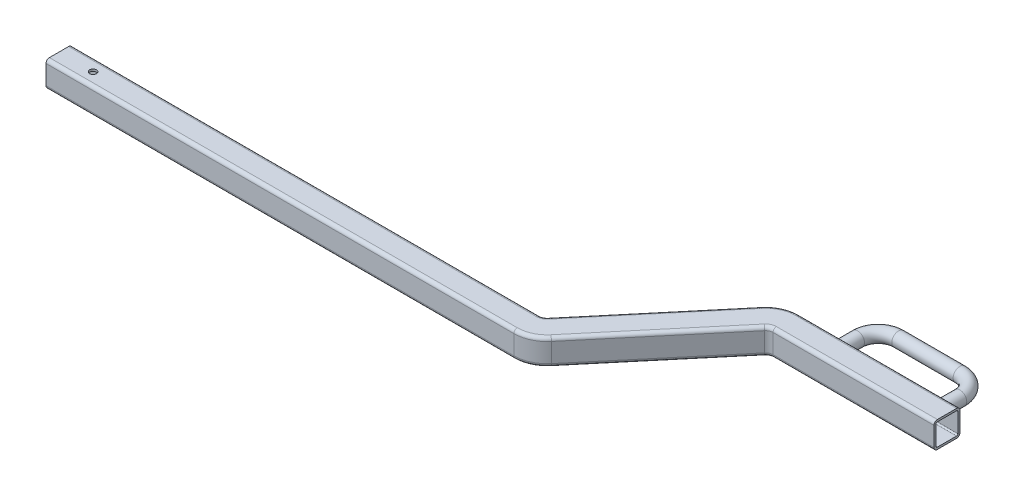
from build123d import *

# Parameters (mm, degrees)
CUT_EXTRUDE3_DEPTH      = 1131.639859977
CUT_EXTRUDE3_DEPTH_BACK = 1131.639859977
SKETCH21_R              = 5
SWEEP_THIN4_PROFILE_R   = 10
SWEEP_THIN4_PROFILE_R_2 = 7


with BuildPart() as part:
    # Sweep-Thin3: sweep along a curve in space
    with BuildLine() as sweep_thin3_path:
        Line((874.686132166, 0, -191.51111078), (1110.696902422, 0, -191.51111078))
        ThreePointArc((851.704798873, 0, -180.79473907), (862.007584314, 0, -188.700344391), (874.686132166, 0, -191.51111078))
        Line((708.992103549, 0, -10.716371709), (851.704798873, 0, -180.79473907))
        ThreePointArc((686.010770255, 0, 0), (698.689318108, 0, -2.810766389), (708.992103549, 0, -10.716371709))
        Line((0, 0, 0), (686.010770255, 0, 0))
    # Sketch2 → Sweep-Thin3 (sweep)
    with BuildSketch(Plane(origin=(0, 0, 0), x_dir=(0, 0, -1), z_dir=(1, 0, 0))):
        with BuildLine():
            Line((14.05, 19.05), (-14.05, 19.05))
            ThreePointArc((-14.05, 19.05), (-17.585533906, 17.585533906), (-19.05, 14.05))
            Line((-19.05, 14.05), (-19.05, -14.05))
            ThreePointArc((-19.05, -14.05), (-17.585533906, -17.585533906), (-14.05, -19.05))
            Line((-14.05, -19.05), (14.05, -19.05))
            ThreePointArc((14.05, -19.05), (17.585533906, -17.585533906), (19.05, -14.05))
            Line((19.05, -14.05), (19.05, 14.05))
            ThreePointArc((19.05, 14.05), (17.585533906, 17.585533906), (14.05, 19.05))
        make_face()
        with BuildLine():
            Line((14.05, 16.05), (-14.05, 16.05))
            ThreePointArc((-14.05, 16.05), (-15.464213562, 15.464213562), (-16.05, 14.05))
            Line((-16.05, 14.05), (-16.05, -14.05))
            ThreePointArc((-16.05, -14.05), (-15.464213562, -15.464213562), (-14.05, -16.05))
            Line((-14.05, -16.05), (14.05, -16.05))
            ThreePointArc((14.05, -16.05), (15.464213562, -15.464213562), (16.05, -14.05))
            Line((16.05, -14.05), (16.05, 14.05))
            ThreePointArc((16.05, 14.05), (15.464213562, 15.464213562), (14.05, 16.05))
        make_face(mode=Mode.SUBTRACT)
    sweep(path=sweep_thin3_path.line)

    # Sketch21 → Cut-Extrude3 (cut, two sides: drawn at the far end of the back side and taken through both)
    with BuildSketch(Plane(origin=(0, 0, 0), x_dir=(1, 0, 0), z_dir=(0, 1, 0)).offset(-CUT_EXTRUDE3_DEPTH_BACK)):
        with Locations((50, 0)):
            Circle(SKETCH21_R)
    extrude(amount=CUT_EXTRUDE3_DEPTH + CUT_EXTRUDE3_DEPTH_BACK, mode=Mode.SUBTRACT)

    # Sweep-Thin4: sweep along a path in Sketch25
    with BuildLine(Plane.XZ) as sweep_thin4_path:
        Line((1080.696902422, -210.56111078), (1080.696902422, -240.56111078))
        ThreePointArc((1080.696902422, -240.56111078), (1071.910105857, -261.774314215), (1050.696902422, -270.56111078))
        Line((1050.696902422, -270.56111078), (960.696902422, -270.56111078))
        ThreePointArc((960.696902422, -270.56111078), (939.483698986, -261.774314215), (930.696902422, -240.56111078))
        Line((930.696902422, -240.56111078), (930.696902422, -210.56111078))
    # Sweep-Thin4 profile (on start of the path) → Sweep-Thin4 (sweep)
    with BuildSketch(Plane(origin=(1080.696902422, 0, -210.56111078), x_dir=(-1, 0, 0), z_dir=(0, 0, -1))):
        Circle(SWEEP_THIN4_PROFILE_R)
        Circle(SWEEP_THIN4_PROFILE_R_2, mode=Mode.SUBTRACT)
    sweep(path=sweep_thin4_path.line)


solid = part.part
